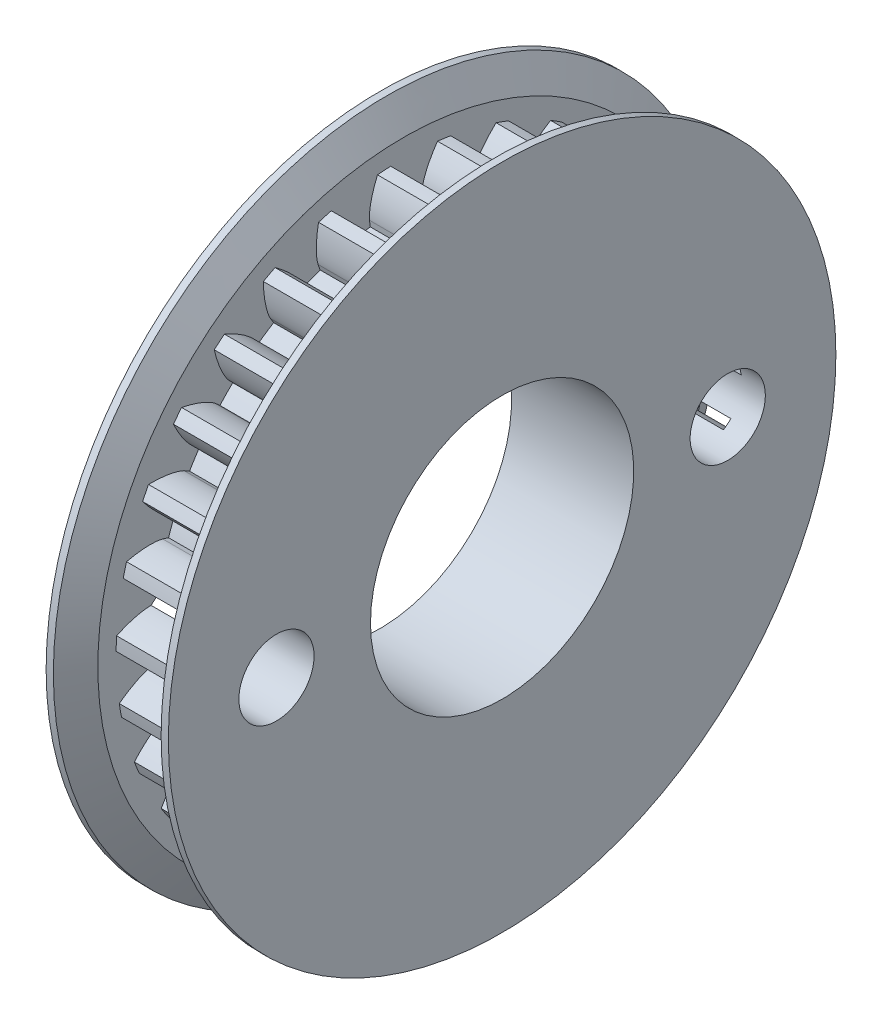
from build123d import *

# Parameters (mm, degrees)
SKETCH1_R                 = 15.278874537
BOSS_EXTRUDE1_DEPTH       = 4
CUT_EXTRUDE1_DEPTH        = 22.974713064
CIRPATTERN6_COUNT         = 30
CIRPATTERN6_COPY_1_DEPTH  = 22.974713064
CIRPATTERN6_COPY_2_DEPTH  = 22.974713064
CIRPATTERN6_COPY_3_DEPTH  = 22.974713064
CIRPATTERN6_COPY_4_DEPTH  = 22.974713064
CIRPATTERN6_COPY_5_DEPTH  = 22.974713064
CIRPATTERN6_COPY_6_DEPTH  = 22.974713064
CIRPATTERN6_COPY_7_DEPTH  = 22.974713064
CIRPATTERN6_COPY_8_DEPTH  = 22.974713064
CIRPATTERN6_COPY_9_DEPTH  = 22.974713064
CIRPATTERN6_COPY_10_DEPTH = 22.974713064
CIRPATTERN6_COPY_11_DEPTH = 22.974713064
CIRPATTERN6_COPY_12_DEPTH = 22.974713064
CIRPATTERN6_COPY_13_DEPTH = 22.974713064
CIRPATTERN6_COPY_14_DEPTH = 22.974713064
CIRPATTERN6_COPY_15_DEPTH = 22.974713064
CIRPATTERN6_COPY_16_DEPTH = 22.974713064
CIRPATTERN6_COPY_17_DEPTH = 22.974713064
CIRPATTERN6_COPY_18_DEPTH = 22.974713064
CIRPATTERN6_COPY_19_DEPTH = 22.974713064
CIRPATTERN6_COPY_20_DEPTH = 22.974713064
CIRPATTERN6_COPY_21_DEPTH = 22.974713064
CIRPATTERN6_COPY_22_DEPTH = 22.974713064
CIRPATTERN6_COPY_23_DEPTH = 22.974713064
CIRPATTERN6_COPY_24_DEPTH = 22.974713064
CIRPATTERN6_COPY_25_DEPTH = 22.974713064
CIRPATTERN6_COPY_26_DEPTH = 22.974713064
CIRPATTERN6_COPY_27_DEPTH = 22.974713064
CIRPATTERN6_COPY_28_DEPTH = 22.974713064
CIRPATTERN6_COPY_29_DEPTH = 22.974713064
SKETCH6_R                 = 7
CUT_EXTRUDE2_DEPTH        = 26.931455592
CUT_EXTRUDE3_DEPTH        = 26.646693531
CUT_EXTRUDE3_DEPTH_BACK   = 26.646693531
SKETCH7_R                 = 2


with BuildPart() as part:
    # Sketch1 → Boss-Extrude1 (new body)
    with BuildSketch(Plane.YZ):
        Circle(SKETCH1_R)
    extrude(amount=BOSS_EXTRUDE1_DEPTH)

    # Sketch3 → Cut-Extrude1 (cut, through all)
    with BuildSketch(Plane.YZ.offset(4)):
        with BuildLine():
            Line((13.450664749, -0.504036274), (14.313898451, -0.536384199))
            Line((14.313898451, -0.536384199), (15.268158348, -0.572143146))
            ThreePointArc((15.268158348, -0.572143146), (15.276195255, -0.286121747), (15.278874537, 0))
            ThreePointArc((15.278874537, 0), (15.275140151, 0.337787637), (15.263938818, 0.675410153))
            add(Edge.make_bspline(
                [(13.460105303, 0), (13.470056402, 0.000210583), (13.49794505, 0.001452893), (13.55055342, 0.006373717), (13.636042534, 0.018043706), (13.744308514, 0.038242293), (13.8832192, 0.070428659), (14.045297726, 0.116107191), (14.221468807, 0.174364449), (14.410716831, 0.246340875), (14.597138914, 0.32567041), (14.78066653, 0.411715422), (14.961146978, 0.503609331), (15.104113083, 0.582178756), (15.201386343, 0.638320962), (15.254446962, 0.66975989), (15.263938818, 0.675410153)],
                knots=[0, 0, 0, 0, 0, 0.005376748, 0.015083688, 0.02853182, 0.046610139, 0.064854849, 0.092110525, 0.119476175, 0.146842495, 0.174208853, 0.201574955, 0.228941013, 0.256307345, 0.262278114, 0.262278114, 0.262278114, 0.262278114, 0.262278114], degree=4))
            Line((13.460105303, 0), (13.130282805, 0))
            ThreePointArc((13.130282805, 0), (13.127980297, -0.245885876), (13.12107358, -0.491685516))
            Line((13.12107358, -0.491685516), (13.450664749, -0.504036274))
        make_face()
    cut_extrude1 = extrude(amount=-CUT_EXTRUDE1_DEPTH, mode=Mode.SUBTRACT)

    # Mirror1: Cut-Extrude1 across plane
    add(cut_extrude1.mirror(Plane(origin=(0, 0, 0), x_dir=(1, 0, 0), z_dir=(0, 0.037446681316417124, 0.999298627067198))), mode=Mode.SUBTRACT)

    # CirPattern6: Cut-Extrude1 ×30 about axis
    cirpattern6_axis = Axis((4, 0, 0), (-1, 0, 0))
    for i in range(1, CIRPATTERN6_COUNT):
        add(cut_extrude1.rotate(cirpattern6_axis, i * 360 / CIRPATTERN6_COUNT), mode=Mode.SUBTRACT)

    # CirPattern6 copy 1 sketch → CirPattern6 copy 1 (cut, through all)
    with BuildSketch(Plane(origin=(4, 0, 0), x_dir=(0, 0.9598440936427466, -0.2805339835013476), z_dir=(1, 0, 0))):
        with BuildLine():
            Line((13.450664749, 0.504036274), (14.313898451, 0.536384199))
            Line((14.313898451, 0.536384199), (15.268158348, 0.572143146))
            ThreePointArc((15.268158348, 0.572143146), (15.276195255, 0.286121747), (15.278874537, 0))
            ThreePointArc((15.278874537, 0), (15.275140151, -0.337787637), (15.263938818, -0.675410153))
            add(Edge.make_bspline(
                [(13.460105303, 0), (13.470056402, -0.000210583), (13.49794505, -0.001452893), (13.55055342, -0.006373717), (13.636042534, -0.018043706), (13.744308514, -0.038242293), (13.8832192, -0.070428659), (14.045297726, -0.116107191), (14.221468807, -0.174364449), (14.410716831, -0.246340875), (14.597138914, -0.32567041), (14.78066653, -0.411715422), (14.961146978, -0.503609331), (15.104113083, -0.582178756), (15.201386343, -0.638320962), (15.254446962, -0.66975989), (15.263938818, -0.675410153)],
                knots=[0, 0, 0, 0, 0, 0.005376748, 0.015083688, 0.02853182, 0.046610139, 0.064854849, 0.092110525, 0.119476175, 0.146842495, 0.174208853, 0.201574955, 0.228941013, 0.256307345, 0.262278114, 0.262278114, 0.262278114, 0.262278114, 0.262278114], degree=4))
            Line((13.460105303, 0), (13.130282805, 0))
            ThreePointArc((13.130282805, 0), (13.127980297, 0.245885876), (13.12107358, 0.491685516))
            Line((13.12107358, 0.491685516), (13.450664749, 0.504036274))
        make_face()
    extrude(amount=-CIRPATTERN6_COPY_1_DEPTH, mode=Mode.SUBTRACT)

    # CirPattern6 copy 2 sketch → CirPattern6 copy 2 (cut, through all)
    with BuildSketch(Plane(origin=(4, 0, 0), x_dir=(0, 0.8805429024335603, -0.47396645131684334), z_dir=(1, 0, 0))):
        with BuildLine():
            Line((13.450664749, 0.504036274), (14.313898451, 0.536384199))
            Line((14.313898451, 0.536384199), (15.268158348, 0.572143146))
            ThreePointArc((15.268158348, 0.572143146), (15.276195255, 0.286121747), (15.278874537, 0))
            ThreePointArc((15.278874537, 0), (15.275140151, -0.337787637), (15.263938818, -0.675410153))
            add(Edge.make_bspline(
                [(13.460105303, 0), (13.470056402, -0.000210583), (13.49794505, -0.001452893), (13.55055342, -0.006373717), (13.636042534, -0.018043706), (13.744308514, -0.038242293), (13.8832192, -0.070428659), (14.045297726, -0.116107191), (14.221468807, -0.174364449), (14.410716831, -0.246340875), (14.597138914, -0.32567041), (14.78066653, -0.411715422), (14.961146978, -0.503609331), (15.104113083, -0.582178756), (15.201386343, -0.638320962), (15.254446962, -0.66975989), (15.263938818, -0.675410153)],
                knots=[0, 0, 0, 0, 0, 0.005376748, 0.015083688, 0.02853182, 0.046610139, 0.064854849, 0.092110525, 0.119476175, 0.146842495, 0.174208853, 0.201574955, 0.228941013, 0.256307345, 0.262278114, 0.262278114, 0.262278114, 0.262278114, 0.262278114], degree=4))
            Line((13.460105303, 0), (13.130282805, 0))
            ThreePointArc((13.130282805, 0), (13.127980297, 0.245885876), (13.12107358, 0.491685516))
            Line((13.12107358, 0.491685516), (13.450664749, 0.504036274))
        make_face()
    extrude(amount=-CIRPATTERN6_COPY_2_DEPTH, mode=Mode.SUBTRACT)

    # CirPattern6 copy 3 sketch → CirPattern6 copy 3 (cut, through all)
    with BuildSketch(Plane(origin=(4, 0, 0), x_dir=(0, 0.7627577610743903, -0.6466843108664252), z_dir=(1, 0, 0))):
        with BuildLine():
            Line((13.450664749, 0.504036274), (14.313898451, 0.536384199))
            Line((14.313898451, 0.536384199), (15.268158348, 0.572143146))
            ThreePointArc((15.268158348, 0.572143146), (15.276195255, 0.286121747), (15.278874537, 0))
            ThreePointArc((15.278874537, 0), (15.275140151, -0.337787637), (15.263938818, -0.675410153))
            add(Edge.make_bspline(
                [(13.460105303, 0), (13.470056402, -0.000210583), (13.49794505, -0.001452893), (13.55055342, -0.006373717), (13.636042534, -0.018043706), (13.744308514, -0.038242293), (13.8832192, -0.070428659), (14.045297726, -0.116107191), (14.221468807, -0.174364449), (14.410716831, -0.246340875), (14.597138914, -0.32567041), (14.78066653, -0.411715422), (14.961146978, -0.503609331), (15.104113083, -0.582178756), (15.201386343, -0.638320962), (15.254446962, -0.66975989), (15.263938818, -0.675410153)],
                knots=[0, 0, 0, 0, 0, 0.005376748, 0.015083688, 0.02853182, 0.046610139, 0.064854849, 0.092110525, 0.119476175, 0.146842495, 0.174208853, 0.201574955, 0.228941013, 0.256307345, 0.262278114, 0.262278114, 0.262278114, 0.262278114, 0.262278114], degree=4))
            Line((13.460105303, 0), (13.130282805, 0))
            ThreePointArc((13.130282805, 0), (13.127980297, 0.245885876), (13.12107358, 0.491685516))
            Line((13.12107358, 0.491685516), (13.450664749, 0.504036274))
        make_face()
    extrude(amount=-CIRPATTERN6_COPY_3_DEPTH, mode=Mode.SUBTRACT)

    # CirPattern6 copy 4 sketch → CirPattern6 copy 4 (cut, through all)
    with BuildSketch(Plane(origin=(4, 0, 0), x_dir=(0, 0.6116364454384483, -0.7911389628955334), z_dir=(1, 0, 0))):
        with BuildLine():
            Line((13.450664749, 0.504036274), (14.313898451, 0.536384199))
            Line((14.313898451, 0.536384199), (15.268158348, 0.572143146))
            ThreePointArc((15.268158348, 0.572143146), (15.276195255, 0.286121747), (15.278874537, 0))
            ThreePointArc((15.278874537, 0), (15.275140151, -0.337787637), (15.263938818, -0.675410153))
            add(Edge.make_bspline(
                [(13.460105303, 0), (13.470056402, -0.000210583), (13.49794505, -0.001452893), (13.55055342, -0.006373717), (13.636042534, -0.018043706), (13.744308514, -0.038242293), (13.8832192, -0.070428659), (14.045297726, -0.116107191), (14.221468807, -0.174364449), (14.410716831, -0.246340875), (14.597138914, -0.32567041), (14.78066653, -0.411715422), (14.961146978, -0.503609331), (15.104113083, -0.582178756), (15.201386343, -0.638320962), (15.254446962, -0.66975989), (15.263938818, -0.675410153)],
                knots=[0, 0, 0, 0, 0, 0.005376748, 0.015083688, 0.02853182, 0.046610139, 0.064854849, 0.092110525, 0.119476175, 0.146842495, 0.174208853, 0.201574955, 0.228941013, 0.256307345, 0.262278114, 0.262278114, 0.262278114, 0.262278114, 0.262278114], degree=4))
            Line((13.460105303, 0), (13.130282805, 0))
            ThreePointArc((13.130282805, 0), (13.127980297, 0.245885876), (13.12107358, 0.491685516))
            Line((13.12107358, 0.491685516), (13.450664749, 0.504036274))
        make_face()
    extrude(amount=-CIRPATTERN6_COPY_4_DEPTH, mode=Mode.SUBTRACT)

    # CirPattern6 copy 5 sketch → CirPattern6 copy 5 (cut, through all)
    with BuildSketch(Plane(origin=(4, 0, 0), x_dir=(0, 0.4337836821795526, -0.9010170459401691), z_dir=(1, 0, 0))):
        with BuildLine():
            Line((13.450664749, 0.504036274), (14.313898451, 0.536384199))
            Line((14.313898451, 0.536384199), (15.268158348, 0.572143146))
            ThreePointArc((15.268158348, 0.572143146), (15.276195255, 0.286121747), (15.278874537, 0))
            ThreePointArc((15.278874537, 0), (15.275140151, -0.337787637), (15.263938818, -0.675410153))
            add(Edge.make_bspline(
                [(13.460105303, 0), (13.470056402, -0.000210583), (13.49794505, -0.001452893), (13.55055342, -0.006373717), (13.636042534, -0.018043706), (13.744308514, -0.038242293), (13.8832192, -0.070428659), (14.045297726, -0.116107191), (14.221468807, -0.174364449), (14.410716831, -0.246340875), (14.597138914, -0.32567041), (14.78066653, -0.411715422), (14.961146978, -0.503609331), (15.104113083, -0.582178756), (15.201386343, -0.638320962), (15.254446962, -0.66975989), (15.263938818, -0.675410153)],
                knots=[0, 0, 0, 0, 0, 0.005376748, 0.015083688, 0.02853182, 0.046610139, 0.064854849, 0.092110525, 0.119476175, 0.146842495, 0.174208853, 0.201574955, 0.228941013, 0.256307345, 0.262278114, 0.262278114, 0.262278114, 0.262278114, 0.262278114], degree=4))
            Line((13.460105303, 0), (13.130282805, 0))
            ThreePointArc((13.130282805, 0), (13.127980297, 0.245885876), (13.12107358, 0.491685516))
            Line((13.12107358, 0.491685516), (13.450664749, 0.504036274))
        make_face()
    extrude(amount=-CIRPATTERN6_COPY_5_DEPTH, mode=Mode.SUBTRACT)

    # CirPattern6 copy 6 sketch → CirPattern6 copy 6 (cut, through all)
    with BuildSketch(Plane(origin=(4, 0, 0), x_dir=(0, 0.23697249048436164, -0.9715163605177419), z_dir=(1, 0, 0))):
        with BuildLine():
            Line((13.450664749, 0.504036274), (14.313898451, 0.536384199))
            Line((14.313898451, 0.536384199), (15.268158348, 0.572143146))
            ThreePointArc((15.268158348, 0.572143146), (15.276195255, 0.286121747), (15.278874537, 0))
            ThreePointArc((15.278874537, 0), (15.275140151, -0.337787637), (15.263938818, -0.675410153))
            add(Edge.make_bspline(
                [(13.460105303, 0), (13.470056402, -0.000210583), (13.49794505, -0.001452893), (13.55055342, -0.006373717), (13.636042534, -0.018043706), (13.744308514, -0.038242293), (13.8832192, -0.070428659), (14.045297726, -0.116107191), (14.221468807, -0.174364449), (14.410716831, -0.246340875), (14.597138914, -0.32567041), (14.78066653, -0.411715422), (14.961146978, -0.503609331), (15.104113083, -0.582178756), (15.201386343, -0.638320962), (15.254446962, -0.66975989), (15.263938818, -0.675410153)],
                knots=[0, 0, 0, 0, 0, 0.005376748, 0.015083688, 0.02853182, 0.046610139, 0.064854849, 0.092110525, 0.119476175, 0.146842495, 0.174208853, 0.201574955, 0.228941013, 0.256307345, 0.262278114, 0.262278114, 0.262278114, 0.262278114, 0.262278114], degree=4))
            Line((13.460105303, 0), (13.130282805, 0))
            ThreePointArc((13.130282805, 0), (13.127980297, 0.245885876), (13.12107358, 0.491685516))
            Line((13.12107358, 0.491685516), (13.450664749, 0.504036274))
        make_face()
    extrude(amount=-CIRPATTERN6_COPY_6_DEPTH, mode=Mode.SUBTRACT)

    # CirPattern6 copy 7 sketch → CirPattern6 copy 7 (cut, through all)
    with BuildSketch(Plane(origin=(4, 0, 0), x_dir=(0, 0.02980446383483333, -0.9995557482879672), z_dir=(1, 0, 0))):
        with BuildLine():
            Line((13.450664749, 0.504036274), (14.313898451, 0.536384199))
            Line((14.313898451, 0.536384199), (15.268158348, 0.572143146))
            ThreePointArc((15.268158348, 0.572143146), (15.276195255, 0.286121747), (15.278874537, 0))
            ThreePointArc((15.278874537, 0), (15.275140151, -0.337787637), (15.263938818, -0.675410153))
            add(Edge.make_bspline(
                [(13.460105303, 0), (13.470056402, -0.000210583), (13.49794505, -0.001452893), (13.55055342, -0.006373717), (13.636042534, -0.018043706), (13.744308514, -0.038242293), (13.8832192, -0.070428659), (14.045297726, -0.116107191), (14.221468807, -0.174364449), (14.410716831, -0.246340875), (14.597138914, -0.32567041), (14.78066653, -0.411715422), (14.961146978, -0.503609331), (15.104113083, -0.582178756), (15.201386343, -0.638320962), (15.254446962, -0.66975989), (15.263938818, -0.675410153)],
                knots=[0, 0, 0, 0, 0, 0.005376748, 0.015083688, 0.02853182, 0.046610139, 0.064854849, 0.092110525, 0.119476175, 0.146842495, 0.174208853, 0.201574955, 0.228941013, 0.256307345, 0.262278114, 0.262278114, 0.262278114, 0.262278114, 0.262278114], degree=4))
            Line((13.460105303, 0), (13.130282805, 0))
            ThreePointArc((13.130282805, 0), (13.127980297, 0.245885876), (13.12107358, 0.491685516))
            Line((13.12107358, 0.491685516), (13.450664749, 0.504036274))
        make_face()
    extrude(amount=-CIRPATTERN6_COPY_7_DEPTH, mode=Mode.SUBTRACT)

    # CirPattern6 copy 8 sketch → CirPattern6 copy 8 (cut, through all)
    with BuildSketch(Plane(origin=(4, 0, 0), x_dir=(0, -0.17866616090196227, -0.9839097534573759), z_dir=(1, 0, 0))):
        with BuildLine():
            Line((13.450664749, 0.504036274), (14.313898451, 0.536384199))
            Line((14.313898451, 0.536384199), (15.268158348, 0.572143146))
            ThreePointArc((15.268158348, 0.572143146), (15.276195255, 0.286121747), (15.278874537, 0))
            ThreePointArc((15.278874537, 0), (15.275140151, -0.337787637), (15.263938818, -0.675410153))
            add(Edge.make_bspline(
                [(13.460105303, 0), (13.470056402, -0.000210583), (13.49794505, -0.001452893), (13.55055342, -0.006373717), (13.636042534, -0.018043706), (13.744308514, -0.038242293), (13.8832192, -0.070428659), (14.045297726, -0.116107191), (14.221468807, -0.174364449), (14.410716831, -0.246340875), (14.597138914, -0.32567041), (14.78066653, -0.411715422), (14.961146978, -0.503609331), (15.104113083, -0.582178756), (15.201386343, -0.638320962), (15.254446962, -0.66975989), (15.263938818, -0.675410153)],
                knots=[0, 0, 0, 0, 0, 0.005376748, 0.015083688, 0.02853182, 0.046610139, 0.064854849, 0.092110525, 0.119476175, 0.146842495, 0.174208853, 0.201574955, 0.228941013, 0.256307345, 0.262278114, 0.262278114, 0.262278114, 0.262278114, 0.262278114], degree=4))
            Line((13.460105303, 0), (13.130282805, 0))
            ThreePointArc((13.130282805, 0), (13.127980297, 0.245885876), (13.12107358, 0.491685516))
            Line((13.12107358, 0.491685516), (13.450664749, 0.504036274))
        make_face()
    extrude(amount=-CIRPATTERN6_COPY_8_DEPTH, mode=Mode.SUBTRACT)

    # CirPattern6 copy 9 sketch → CirPattern6 copy 9 (cut, through all)
    with BuildSketch(Plane(origin=(4, 0, 0), x_dir=(0, -0.37932821707198205, -0.9252621810778777), z_dir=(1, 0, 0))):
        with BuildLine():
            Line((13.450664749, 0.504036274), (14.313898451, 0.536384199))
            Line((14.313898451, 0.536384199), (15.268158348, 0.572143146))
            ThreePointArc((15.268158348, 0.572143146), (15.276195255, 0.286121747), (15.278874537, 0))
            ThreePointArc((15.278874537, 0), (15.275140151, -0.337787637), (15.263938818, -0.675410153))
            add(Edge.make_bspline(
                [(13.460105303, 0), (13.470056402, -0.000210583), (13.49794505, -0.001452893), (13.55055342, -0.006373717), (13.636042534, -0.018043706), (13.744308514, -0.038242293), (13.8832192, -0.070428659), (14.045297726, -0.116107191), (14.221468807, -0.174364449), (14.410716831, -0.246340875), (14.597138914, -0.32567041), (14.78066653, -0.411715422), (14.961146978, -0.503609331), (15.104113083, -0.582178756), (15.201386343, -0.638320962), (15.254446962, -0.66975989), (15.263938818, -0.675410153)],
                knots=[0, 0, 0, 0, 0, 0.005376748, 0.015083688, 0.02853182, 0.046610139, 0.064854849, 0.092110525, 0.119476175, 0.146842495, 0.174208853, 0.201574955, 0.228941013, 0.256307345, 0.262278114, 0.262278114, 0.262278114, 0.262278114, 0.262278114], degree=4))
            Line((13.460105303, 0), (13.130282805, 0))
            ThreePointArc((13.130282805, 0), (13.127980297, 0.245885876), (13.12107358, 0.491685516))
            Line((13.12107358, 0.491685516), (13.450664749, 0.504036274))
        make_face()
    extrude(amount=-CIRPATTERN6_COPY_9_DEPTH, mode=Mode.SUBTRACT)

    # CirPattern6 copy 10 sketch → CirPattern6 copy 10 (cut, through all)
    with BuildSketch(Plane(origin=(4, 0, 0), x_dir=(0, -0.5634118099372207, -0.8261762114847322), z_dir=(1, 0, 0))):
        with BuildLine():
            Line((13.450664749, 0.504036274), (14.313898451, 0.536384199))
            Line((14.313898451, 0.536384199), (15.268158348, 0.572143146))
            ThreePointArc((15.268158348, 0.572143146), (15.276195255, 0.286121747), (15.278874537, 0))
            ThreePointArc((15.278874537, 0), (15.275140151, -0.337787637), (15.263938818, -0.675410153))
            add(Edge.make_bspline(
                [(13.460105303, 0), (13.470056402, -0.000210583), (13.49794505, -0.001452893), (13.55055342, -0.006373717), (13.636042534, -0.018043706), (13.744308514, -0.038242293), (13.8832192, -0.070428659), (14.045297726, -0.116107191), (14.221468807, -0.174364449), (14.410716831, -0.246340875), (14.597138914, -0.32567041), (14.78066653, -0.411715422), (14.961146978, -0.503609331), (15.104113083, -0.582178756), (15.201386343, -0.638320962), (15.254446962, -0.66975989), (15.263938818, -0.675410153)],
                knots=[0, 0, 0, 0, 0, 0.005376748, 0.015083688, 0.02853182, 0.046610139, 0.064854849, 0.092110525, 0.119476175, 0.146842495, 0.174208853, 0.201574955, 0.228941013, 0.256307345, 0.262278114, 0.262278114, 0.262278114, 0.262278114, 0.262278114], degree=4))
            Line((13.460105303, 0), (13.130282805, 0))
            ThreePointArc((13.130282805, 0), (13.127980297, 0.245885876), (13.12107358, 0.491685516))
            Line((13.12107358, 0.491685516), (13.450664749, 0.504036274))
        make_face()
    extrude(amount=-CIRPATTERN6_COPY_10_DEPTH, mode=Mode.SUBTRACT)

    # CirPattern6 copy 11 sketch → CirPattern6 copy 11 (cut, through all)
    with BuildSketch(Plane(origin=(4, 0, 0), x_dir=(0, -0.722871603158385, -0.6909823770163943), z_dir=(1, 0, 0))):
        with BuildLine():
            Line((13.450664749, 0.504036274), (14.313898451, 0.536384199))
            Line((14.313898451, 0.536384199), (15.268158348, 0.572143146))
            ThreePointArc((15.268158348, 0.572143146), (15.276195255, 0.286121747), (15.278874537, 0))
            ThreePointArc((15.278874537, 0), (15.275140151, -0.337787637), (15.263938818, -0.675410153))
            add(Edge.make_bspline(
                [(13.460105303, 0), (13.470056402, -0.000210583), (13.49794505, -0.001452893), (13.55055342, -0.006373717), (13.636042534, -0.018043706), (13.744308514, -0.038242293), (13.8832192, -0.070428659), (14.045297726, -0.116107191), (14.221468807, -0.174364449), (14.410716831, -0.246340875), (14.597138914, -0.32567041), (14.78066653, -0.411715422), (14.961146978, -0.503609331), (15.104113083, -0.582178756), (15.201386343, -0.638320962), (15.254446962, -0.66975989), (15.263938818, -0.675410153)],
                knots=[0, 0, 0, 0, 0, 0.005376748, 0.015083688, 0.02853182, 0.046610139, 0.064854849, 0.092110525, 0.119476175, 0.146842495, 0.174208853, 0.201574955, 0.228941013, 0.256307345, 0.262278114, 0.262278114, 0.262278114, 0.262278114, 0.262278114], degree=4))
            Line((13.460105303, 0), (13.130282805, 0))
            ThreePointArc((13.130282805, 0), (13.127980297, 0.245885876), (13.12107358, 0.491685516))
            Line((13.12107358, 0.491685516), (13.450664749, 0.504036274))
        make_face()
    extrude(amount=-CIRPATTERN6_COPY_11_DEPTH, mode=Mode.SUBTRACT)

    # CirPattern6 copy 12 sketch → CirPattern6 copy 12 (cut, through all)
    with BuildSketch(Plane(origin=(4, 0, 0), x_dir=(0, -0.8507384385987268, -0.525589296971124), z_dir=(1, 0, 0))):
        with BuildLine():
            Line((13.450664749, 0.504036274), (14.313898451, 0.536384199))
            Line((14.313898451, 0.536384199), (15.268158348, 0.572143146))
            ThreePointArc((15.268158348, 0.572143146), (15.276195255, 0.286121747), (15.278874537, 0))
            ThreePointArc((15.278874537, 0), (15.275140151, -0.337787637), (15.263938818, -0.675410153))
            add(Edge.make_bspline(
                [(13.460105303, 0), (13.470056402, -0.000210583), (13.49794505, -0.001452893), (13.55055342, -0.006373717), (13.636042534, -0.018043706), (13.744308514, -0.038242293), (13.8832192, -0.070428659), (14.045297726, -0.116107191), (14.221468807, -0.174364449), (14.410716831, -0.246340875), (14.597138914, -0.32567041), (14.78066653, -0.411715422), (14.961146978, -0.503609331), (15.104113083, -0.582178756), (15.201386343, -0.638320962), (15.254446962, -0.66975989), (15.263938818, -0.675410153)],
                knots=[0, 0, 0, 0, 0, 0.005376748, 0.015083688, 0.02853182, 0.046610139, 0.064854849, 0.092110525, 0.119476175, 0.146842495, 0.174208853, 0.201574955, 0.228941013, 0.256307345, 0.262278114, 0.262278114, 0.262278114, 0.262278114, 0.262278114], degree=4))
            Line((13.460105303, 0), (13.130282805, 0))
            ThreePointArc((13.130282805, 0), (13.127980297, 0.245885876), (13.12107358, 0.491685516))
            Line((13.12107358, 0.491685516), (13.450664749, 0.504036274))
        make_face()
    extrude(amount=-CIRPATTERN6_COPY_12_DEPTH, mode=Mode.SUBTRACT)

    # CirPattern6 copy 13 sketch → CirPattern6 copy 13 (cut, through all)
    with BuildSketch(Plane(origin=(4, 0, 0), x_dir=(0, -0.9414239219763524, -0.3372254425909509), z_dir=(1, 0, 0))):
        with BuildLine():
            Line((13.450664749, 0.504036274), (14.313898451, 0.536384199))
            Line((14.313898451, 0.536384199), (15.268158348, 0.572143146))
            ThreePointArc((15.268158348, 0.572143146), (15.276195255, 0.286121747), (15.278874537, 0))
            ThreePointArc((15.278874537, 0), (15.275140151, -0.337787637), (15.263938818, -0.675410153))
            add(Edge.make_bspline(
                [(13.460105303, 0), (13.470056402, -0.000210583), (13.49794505, -0.001452893), (13.55055342, -0.006373717), (13.636042534, -0.018043706), (13.744308514, -0.038242293), (13.8832192, -0.070428659), (14.045297726, -0.116107191), (14.221468807, -0.174364449), (14.410716831, -0.246340875), (14.597138914, -0.32567041), (14.78066653, -0.411715422), (14.961146978, -0.503609331), (15.104113083, -0.582178756), (15.201386343, -0.638320962), (15.254446962, -0.66975989), (15.263938818, -0.675410153)],
                knots=[0, 0, 0, 0, 0, 0.005376748, 0.015083688, 0.02853182, 0.046610139, 0.064854849, 0.092110525, 0.119476175, 0.146842495, 0.174208853, 0.201574955, 0.228941013, 0.256307345, 0.262278114, 0.262278114, 0.262278114, 0.262278114, 0.262278114], degree=4))
            Line((13.460105303, 0), (13.130282805, 0))
            ThreePointArc((13.130282805, 0), (13.127980297, 0.245885876), (13.12107358, 0.491685516))
            Line((13.12107358, 0.491685516), (13.450664749, 0.504036274))
        make_face()
    extrude(amount=-CIRPATTERN6_COPY_13_DEPTH, mode=Mode.SUBTRACT)

    # CirPattern6 copy 14 sketch → CirPattern6 copy 14 (cut, through all)
    with BuildSketch(Plane(origin=(4, 0, 0), x_dir=(0, -0.9909646625104305, -0.13412321818234424), z_dir=(1, 0, 0))):
        with BuildLine():
            Line((13.450664749, 0.504036274), (14.313898451, 0.536384199))
            Line((14.313898451, 0.536384199), (15.268158348, 0.572143146))
            ThreePointArc((15.268158348, 0.572143146), (15.276195255, 0.286121747), (15.278874537, 0))
            ThreePointArc((15.278874537, 0), (15.275140151, -0.337787637), (15.263938818, -0.675410153))
            add(Edge.make_bspline(
                [(13.460105303, 0), (13.470056402, -0.000210583), (13.49794505, -0.001452893), (13.55055342, -0.006373717), (13.636042534, -0.018043706), (13.744308514, -0.038242293), (13.8832192, -0.070428659), (14.045297726, -0.116107191), (14.221468807, -0.174364449), (14.410716831, -0.246340875), (14.597138914, -0.32567041), (14.78066653, -0.411715422), (14.961146978, -0.503609331), (15.104113083, -0.582178756), (15.201386343, -0.638320962), (15.254446962, -0.66975989), (15.263938818, -0.675410153)],
                knots=[0, 0, 0, 0, 0, 0.005376748, 0.015083688, 0.02853182, 0.046610139, 0.064854849, 0.092110525, 0.119476175, 0.146842495, 0.174208853, 0.201574955, 0.228941013, 0.256307345, 0.262278114, 0.262278114, 0.262278114, 0.262278114, 0.262278114], degree=4))
            Line((13.460105303, 0), (13.130282805, 0))
            ThreePointArc((13.130282805, 0), (13.127980297, 0.245885876), (13.12107358, 0.491685516))
            Line((13.12107358, 0.491685516), (13.450664749, 0.504036274))
        make_face()
    extrude(amount=-CIRPATTERN6_COPY_14_DEPTH, mode=Mode.SUBTRACT)

    # CirPattern6 copy 15 sketch → CirPattern6 copy 15 (cut, through all)
    with BuildSketch(Plane(origin=(4, 0, 0), x_dir=(0, -0.9971954921167734, 0.07484083445543692), z_dir=(1, 0, 0))):
        with BuildLine():
            Line((13.450664749, 0.504036274), (14.313898451, 0.536384199))
            Line((14.313898451, 0.536384199), (15.268158348, 0.572143146))
            ThreePointArc((15.268158348, 0.572143146), (15.276195255, 0.286121747), (15.278874537, 0))
            ThreePointArc((15.278874537, 0), (15.275140151, -0.337787637), (15.263938818, -0.675410153))
            add(Edge.make_bspline(
                [(13.460105303, 0), (13.470056402, -0.000210583), (13.49794505, -0.001452893), (13.55055342, -0.006373717), (13.636042534, -0.018043706), (13.744308514, -0.038242293), (13.8832192, -0.070428659), (14.045297726, -0.116107191), (14.221468807, -0.174364449), (14.410716831, -0.246340875), (14.597138914, -0.32567041), (14.78066653, -0.411715422), (14.961146978, -0.503609331), (15.104113083, -0.582178756), (15.201386343, -0.638320962), (15.254446962, -0.66975989), (15.263938818, -0.675410153)],
                knots=[0, 0, 0, 0, 0, 0.005376748, 0.015083688, 0.02853182, 0.046610139, 0.064854849, 0.092110525, 0.119476175, 0.146842495, 0.174208853, 0.201574955, 0.228941013, 0.256307345, 0.262278114, 0.262278114, 0.262278114, 0.262278114, 0.262278114], degree=4))
            Line((13.460105303, 0), (13.130282805, 0))
            ThreePointArc((13.130282805, 0), (13.127980297, 0.245885876), (13.12107358, 0.491685516))
            Line((13.12107358, 0.491685516), (13.450664749, 0.504036274))
        make_face()
    extrude(amount=-CIRPATTERN6_COPY_15_DEPTH, mode=Mode.SUBTRACT)

    # CirPattern6 copy 16 sketch → CirPattern6 copy 16 (cut, through all)
    with BuildSketch(Plane(origin=(4, 0, 0), x_dir=(0, -0.9598440936427465, 0.2805339835013478), z_dir=(1, 0, 0))):
        with BuildLine():
            Line((13.450664749, 0.504036274), (14.313898451, 0.536384199))
            Line((14.313898451, 0.536384199), (15.268158348, 0.572143146))
            ThreePointArc((15.268158348, 0.572143146), (15.276195255, 0.286121747), (15.278874537, 0))
            ThreePointArc((15.278874537, 0), (15.275140151, -0.337787637), (15.263938818, -0.675410153))
            add(Edge.make_bspline(
                [(13.460105303, 0), (13.470056402, -0.000210583), (13.49794505, -0.001452893), (13.55055342, -0.006373717), (13.636042534, -0.018043706), (13.744308514, -0.038242293), (13.8832192, -0.070428659), (14.045297726, -0.116107191), (14.221468807, -0.174364449), (14.410716831, -0.246340875), (14.597138914, -0.32567041), (14.78066653, -0.411715422), (14.961146978, -0.503609331), (15.104113083, -0.582178756), (15.201386343, -0.638320962), (15.254446962, -0.66975989), (15.263938818, -0.675410153)],
                knots=[0, 0, 0, 0, 0, 0.005376748, 0.015083688, 0.02853182, 0.046610139, 0.064854849, 0.092110525, 0.119476175, 0.146842495, 0.174208853, 0.201574955, 0.228941013, 0.256307345, 0.262278114, 0.262278114, 0.262278114, 0.262278114, 0.262278114], degree=4))
            Line((13.460105303, 0), (13.130282805, 0))
            ThreePointArc((13.130282805, 0), (13.127980297, 0.245885876), (13.12107358, 0.491685516))
            Line((13.12107358, 0.491685516), (13.450664749, 0.504036274))
        make_face()
    extrude(amount=-CIRPATTERN6_COPY_16_DEPTH, mode=Mode.SUBTRACT)

    # CirPattern6 copy 17 sketch → CirPattern6 copy 17 (cut, through all)
    with BuildSketch(Plane(origin=(4, 0, 0), x_dir=(0, -0.8805429024335603, 0.47396645131684334), z_dir=(1, 0, 0))):
        with BuildLine():
            Line((13.450664749, 0.504036274), (14.313898451, 0.536384199))
            Line((14.313898451, 0.536384199), (15.268158348, 0.572143146))
            ThreePointArc((15.268158348, 0.572143146), (15.276195255, 0.286121747), (15.278874537, 0))
            ThreePointArc((15.278874537, 0), (15.275140151, -0.337787637), (15.263938818, -0.675410153))
            add(Edge.make_bspline(
                [(13.460105303, 0), (13.470056402, -0.000210583), (13.49794505, -0.001452893), (13.55055342, -0.006373717), (13.636042534, -0.018043706), (13.744308514, -0.038242293), (13.8832192, -0.070428659), (14.045297726, -0.116107191), (14.221468807, -0.174364449), (14.410716831, -0.246340875), (14.597138914, -0.32567041), (14.78066653, -0.411715422), (14.961146978, -0.503609331), (15.104113083, -0.582178756), (15.201386343, -0.638320962), (15.254446962, -0.66975989), (15.263938818, -0.675410153)],
                knots=[0, 0, 0, 0, 0, 0.005376748, 0.015083688, 0.02853182, 0.046610139, 0.064854849, 0.092110525, 0.119476175, 0.146842495, 0.174208853, 0.201574955, 0.228941013, 0.256307345, 0.262278114, 0.262278114, 0.262278114, 0.262278114, 0.262278114], degree=4))
            Line((13.460105303, 0), (13.130282805, 0))
            ThreePointArc((13.130282805, 0), (13.127980297, 0.245885876), (13.12107358, 0.491685516))
            Line((13.12107358, 0.491685516), (13.450664749, 0.504036274))
        make_face()
    extrude(amount=-CIRPATTERN6_COPY_17_DEPTH, mode=Mode.SUBTRACT)

    # CirPattern6 copy 18 sketch → CirPattern6 copy 18 (cut, through all)
    with BuildSketch(Plane(origin=(4, 0, 0), x_dir=(0, -0.7627577610743904, 0.6466843108664251), z_dir=(1, 0, 0))):
        with BuildLine():
            Line((13.450664749, 0.504036274), (14.313898451, 0.536384199))
            Line((14.313898451, 0.536384199), (15.268158348, 0.572143146))
            ThreePointArc((15.268158348, 0.572143146), (15.276195255, 0.286121747), (15.278874537, 0))
            ThreePointArc((15.278874537, 0), (15.275140151, -0.337787637), (15.263938818, -0.675410153))
            add(Edge.make_bspline(
                [(13.460105303, 0), (13.470056402, -0.000210583), (13.49794505, -0.001452893), (13.55055342, -0.006373717), (13.636042534, -0.018043706), (13.744308514, -0.038242293), (13.8832192, -0.070428659), (14.045297726, -0.116107191), (14.221468807, -0.174364449), (14.410716831, -0.246340875), (14.597138914, -0.32567041), (14.78066653, -0.411715422), (14.961146978, -0.503609331), (15.104113083, -0.582178756), (15.201386343, -0.638320962), (15.254446962, -0.66975989), (15.263938818, -0.675410153)],
                knots=[0, 0, 0, 0, 0, 0.005376748, 0.015083688, 0.02853182, 0.046610139, 0.064854849, 0.092110525, 0.119476175, 0.146842495, 0.174208853, 0.201574955, 0.228941013, 0.256307345, 0.262278114, 0.262278114, 0.262278114, 0.262278114, 0.262278114], degree=4))
            Line((13.460105303, 0), (13.130282805, 0))
            ThreePointArc((13.130282805, 0), (13.127980297, 0.245885876), (13.12107358, 0.491685516))
            Line((13.12107358, 0.491685516), (13.450664749, 0.504036274))
        make_face()
    extrude(amount=-CIRPATTERN6_COPY_18_DEPTH, mode=Mode.SUBTRACT)

    # CirPattern6 copy 19 sketch → CirPattern6 copy 19 (cut, through all)
    with BuildSketch(Plane(origin=(4, 0, 0), x_dir=(0, -0.6116364454384482, 0.7911389628955335), z_dir=(1, 0, 0))):
        with BuildLine():
            Line((13.450664749, 0.504036274), (14.313898451, 0.536384199))
            Line((14.313898451, 0.536384199), (15.268158348, 0.572143146))
            ThreePointArc((15.268158348, 0.572143146), (15.276195255, 0.286121747), (15.278874537, 0))
            ThreePointArc((15.278874537, 0), (15.275140151, -0.337787637), (15.263938818, -0.675410153))
            add(Edge.make_bspline(
                [(13.460105303, 0), (13.470056402, -0.000210583), (13.49794505, -0.001452893), (13.55055342, -0.006373717), (13.636042534, -0.018043706), (13.744308514, -0.038242293), (13.8832192, -0.070428659), (14.045297726, -0.116107191), (14.221468807, -0.174364449), (14.410716831, -0.246340875), (14.597138914, -0.32567041), (14.78066653, -0.411715422), (14.961146978, -0.503609331), (15.104113083, -0.582178756), (15.201386343, -0.638320962), (15.254446962, -0.66975989), (15.263938818, -0.675410153)],
                knots=[0, 0, 0, 0, 0, 0.005376748, 0.015083688, 0.02853182, 0.046610139, 0.064854849, 0.092110525, 0.119476175, 0.146842495, 0.174208853, 0.201574955, 0.228941013, 0.256307345, 0.262278114, 0.262278114, 0.262278114, 0.262278114, 0.262278114], degree=4))
            Line((13.460105303, 0), (13.130282805, 0))
            ThreePointArc((13.130282805, 0), (13.127980297, 0.245885876), (13.12107358, 0.491685516))
            Line((13.12107358, 0.491685516), (13.450664749, 0.504036274))
        make_face()
    extrude(amount=-CIRPATTERN6_COPY_19_DEPTH, mode=Mode.SUBTRACT)

    # CirPattern6 copy 20 sketch → CirPattern6 copy 20 (cut, through all)
    with BuildSketch(Plane(origin=(4, 0, 0), x_dir=(0, -0.433783682179553, 0.901017045940169), z_dir=(1, 0, 0))):
        with BuildLine():
            Line((13.450664749, 0.504036274), (14.313898451, 0.536384199))
            Line((14.313898451, 0.536384199), (15.268158348, 0.572143146))
            ThreePointArc((15.268158348, 0.572143146), (15.276195255, 0.286121747), (15.278874537, 0))
            ThreePointArc((15.278874537, 0), (15.275140151, -0.337787637), (15.263938818, -0.675410153))
            add(Edge.make_bspline(
                [(13.460105303, 0), (13.470056402, -0.000210583), (13.49794505, -0.001452893), (13.55055342, -0.006373717), (13.636042534, -0.018043706), (13.744308514, -0.038242293), (13.8832192, -0.070428659), (14.045297726, -0.116107191), (14.221468807, -0.174364449), (14.410716831, -0.246340875), (14.597138914, -0.32567041), (14.78066653, -0.411715422), (14.961146978, -0.503609331), (15.104113083, -0.582178756), (15.201386343, -0.638320962), (15.254446962, -0.66975989), (15.263938818, -0.675410153)],
                knots=[0, 0, 0, 0, 0, 0.005376748, 0.015083688, 0.02853182, 0.046610139, 0.064854849, 0.092110525, 0.119476175, 0.146842495, 0.174208853, 0.201574955, 0.228941013, 0.256307345, 0.262278114, 0.262278114, 0.262278114, 0.262278114, 0.262278114], degree=4))
            Line((13.460105303, 0), (13.130282805, 0))
            ThreePointArc((13.130282805, 0), (13.127980297, 0.245885876), (13.12107358, 0.491685516))
            Line((13.12107358, 0.491685516), (13.450664749, 0.504036274))
        make_face()
    extrude(amount=-CIRPATTERN6_COPY_20_DEPTH, mode=Mode.SUBTRACT)

    # CirPattern6 copy 21 sketch → CirPattern6 copy 21 (cut, through all)
    with BuildSketch(Plane(origin=(4, 0, 0), x_dir=(0, -0.23697249048436175, 0.9715163605177419), z_dir=(1, 0, 0))):
        with BuildLine():
            Line((13.450664749, 0.504036274), (14.313898451, 0.536384199))
            Line((14.313898451, 0.536384199), (15.268158348, 0.572143146))
            ThreePointArc((15.268158348, 0.572143146), (15.276195255, 0.286121747), (15.278874537, 0))
            ThreePointArc((15.278874537, 0), (15.275140151, -0.337787637), (15.263938818, -0.675410153))
            add(Edge.make_bspline(
                [(13.460105303, 0), (13.470056402, -0.000210583), (13.49794505, -0.001452893), (13.55055342, -0.006373717), (13.636042534, -0.018043706), (13.744308514, -0.038242293), (13.8832192, -0.070428659), (14.045297726, -0.116107191), (14.221468807, -0.174364449), (14.410716831, -0.246340875), (14.597138914, -0.32567041), (14.78066653, -0.411715422), (14.961146978, -0.503609331), (15.104113083, -0.582178756), (15.201386343, -0.638320962), (15.254446962, -0.66975989), (15.263938818, -0.675410153)],
                knots=[0, 0, 0, 0, 0, 0.005376748, 0.015083688, 0.02853182, 0.046610139, 0.064854849, 0.092110525, 0.119476175, 0.146842495, 0.174208853, 0.201574955, 0.228941013, 0.256307345, 0.262278114, 0.262278114, 0.262278114, 0.262278114, 0.262278114], degree=4))
            Line((13.460105303, 0), (13.130282805, 0))
            ThreePointArc((13.130282805, 0), (13.127980297, 0.245885876), (13.12107358, 0.491685516))
            Line((13.12107358, 0.491685516), (13.450664749, 0.504036274))
        make_face()
    extrude(amount=-CIRPATTERN6_COPY_21_DEPTH, mode=Mode.SUBTRACT)

    # CirPattern6 copy 22 sketch → CirPattern6 copy 22 (cut, through all)
    with BuildSketch(Plane(origin=(4, 0, 0), x_dir=(0, -0.02980446383483322, 0.9995557482879673), z_dir=(1, 0, 0))):
        with BuildLine():
            Line((13.450664749, 0.504036274), (14.313898451, 0.536384199))
            Line((14.313898451, 0.536384199), (15.268158348, 0.572143146))
            ThreePointArc((15.268158348, 0.572143146), (15.276195255, 0.286121747), (15.278874537, 0))
            ThreePointArc((15.278874537, 0), (15.275140151, -0.337787637), (15.263938818, -0.675410153))
            add(Edge.make_bspline(
                [(13.460105303, 0), (13.470056402, -0.000210583), (13.49794505, -0.001452893), (13.55055342, -0.006373717), (13.636042534, -0.018043706), (13.744308514, -0.038242293), (13.8832192, -0.070428659), (14.045297726, -0.116107191), (14.221468807, -0.174364449), (14.410716831, -0.246340875), (14.597138914, -0.32567041), (14.78066653, -0.411715422), (14.961146978, -0.503609331), (15.104113083, -0.582178756), (15.201386343, -0.638320962), (15.254446962, -0.66975989), (15.263938818, -0.675410153)],
                knots=[0, 0, 0, 0, 0, 0.005376748, 0.015083688, 0.02853182, 0.046610139, 0.064854849, 0.092110525, 0.119476175, 0.146842495, 0.174208853, 0.201574955, 0.228941013, 0.256307345, 0.262278114, 0.262278114, 0.262278114, 0.262278114, 0.262278114], degree=4))
            Line((13.460105303, 0), (13.130282805, 0))
            ThreePointArc((13.130282805, 0), (13.127980297, 0.245885876), (13.12107358, 0.491685516))
            Line((13.12107358, 0.491685516), (13.450664749, 0.504036274))
        make_face()
    extrude(amount=-CIRPATTERN6_COPY_22_DEPTH, mode=Mode.SUBTRACT)

    # CirPattern6 copy 23 sketch → CirPattern6 copy 23 (cut, through all)
    with BuildSketch(Plane(origin=(4, 0, 0), x_dir=(0, 0.17866616090196175, 0.983909753457376), z_dir=(1, 0, 0))):
        with BuildLine():
            Line((13.450664749, 0.504036274), (14.313898451, 0.536384199))
            Line((14.313898451, 0.536384199), (15.268158348, 0.572143146))
            ThreePointArc((15.268158348, 0.572143146), (15.276195255, 0.286121747), (15.278874537, 0))
            ThreePointArc((15.278874537, 0), (15.275140151, -0.337787637), (15.263938818, -0.675410153))
            add(Edge.make_bspline(
                [(13.460105303, 0), (13.470056402, -0.000210583), (13.49794505, -0.001452893), (13.55055342, -0.006373717), (13.636042534, -0.018043706), (13.744308514, -0.038242293), (13.8832192, -0.070428659), (14.045297726, -0.116107191), (14.221468807, -0.174364449), (14.410716831, -0.246340875), (14.597138914, -0.32567041), (14.78066653, -0.411715422), (14.961146978, -0.503609331), (15.104113083, -0.582178756), (15.201386343, -0.638320962), (15.254446962, -0.66975989), (15.263938818, -0.675410153)],
                knots=[0, 0, 0, 0, 0, 0.005376748, 0.015083688, 0.02853182, 0.046610139, 0.064854849, 0.092110525, 0.119476175, 0.146842495, 0.174208853, 0.201574955, 0.228941013, 0.256307345, 0.262278114, 0.262278114, 0.262278114, 0.262278114, 0.262278114], degree=4))
            Line((13.460105303, 0), (13.130282805, 0))
            ThreePointArc((13.130282805, 0), (13.127980297, 0.245885876), (13.12107358, 0.491685516))
            Line((13.12107358, 0.491685516), (13.450664749, 0.504036274))
        make_face()
    extrude(amount=-CIRPATTERN6_COPY_23_DEPTH, mode=Mode.SUBTRACT)

    # CirPattern6 copy 24 sketch → CirPattern6 copy 24 (cut, through all)
    with BuildSketch(Plane(origin=(4, 0, 0), x_dir=(0, 0.37932821707198194, 0.9252621810778777), z_dir=(1, 0, 0))):
        with BuildLine():
            Line((13.450664749, 0.504036274), (14.313898451, 0.536384199))
            Line((14.313898451, 0.536384199), (15.268158348, 0.572143146))
            ThreePointArc((15.268158348, 0.572143146), (15.276195255, 0.286121747), (15.278874537, 0))
            ThreePointArc((15.278874537, 0), (15.275140151, -0.337787637), (15.263938818, -0.675410153))
            add(Edge.make_bspline(
                [(13.460105303, 0), (13.470056402, -0.000210583), (13.49794505, -0.001452893), (13.55055342, -0.006373717), (13.636042534, -0.018043706), (13.744308514, -0.038242293), (13.8832192, -0.070428659), (14.045297726, -0.116107191), (14.221468807, -0.174364449), (14.410716831, -0.246340875), (14.597138914, -0.32567041), (14.78066653, -0.411715422), (14.961146978, -0.503609331), (15.104113083, -0.582178756), (15.201386343, -0.638320962), (15.254446962, -0.66975989), (15.263938818, -0.675410153)],
                knots=[0, 0, 0, 0, 0, 0.005376748, 0.015083688, 0.02853182, 0.046610139, 0.064854849, 0.092110525, 0.119476175, 0.146842495, 0.174208853, 0.201574955, 0.228941013, 0.256307345, 0.262278114, 0.262278114, 0.262278114, 0.262278114, 0.262278114], degree=4))
            Line((13.460105303, 0), (13.130282805, 0))
            ThreePointArc((13.130282805, 0), (13.127980297, 0.245885876), (13.12107358, 0.491685516))
            Line((13.12107358, 0.491685516), (13.450664749, 0.504036274))
        make_face()
    extrude(amount=-CIRPATTERN6_COPY_24_DEPTH, mode=Mode.SUBTRACT)

    # CirPattern6 copy 25 sketch → CirPattern6 copy 25 (cut, through all)
    with BuildSketch(Plane(origin=(4, 0, 0), x_dir=(0, 0.563411809937221, 0.8261762114847321), z_dir=(1, 0, 0))):
        with BuildLine():
            Line((13.450664749, 0.504036274), (14.313898451, 0.536384199))
            Line((14.313898451, 0.536384199), (15.268158348, 0.572143146))
            ThreePointArc((15.268158348, 0.572143146), (15.276195255, 0.286121747), (15.278874537, 0))
            ThreePointArc((15.278874537, 0), (15.275140151, -0.337787637), (15.263938818, -0.675410153))
            add(Edge.make_bspline(
                [(13.460105303, 0), (13.470056402, -0.000210583), (13.49794505, -0.001452893), (13.55055342, -0.006373717), (13.636042534, -0.018043706), (13.744308514, -0.038242293), (13.8832192, -0.070428659), (14.045297726, -0.116107191), (14.221468807, -0.174364449), (14.410716831, -0.246340875), (14.597138914, -0.32567041), (14.78066653, -0.411715422), (14.961146978, -0.503609331), (15.104113083, -0.582178756), (15.201386343, -0.638320962), (15.254446962, -0.66975989), (15.263938818, -0.675410153)],
                knots=[0, 0, 0, 0, 0, 0.005376748, 0.015083688, 0.02853182, 0.046610139, 0.064854849, 0.092110525, 0.119476175, 0.146842495, 0.174208853, 0.201574955, 0.228941013, 0.256307345, 0.262278114, 0.262278114, 0.262278114, 0.262278114, 0.262278114], degree=4))
            Line((13.460105303, 0), (13.130282805, 0))
            ThreePointArc((13.130282805, 0), (13.127980297, 0.245885876), (13.12107358, 0.491685516))
            Line((13.12107358, 0.491685516), (13.450664749, 0.504036274))
        make_face()
    extrude(amount=-CIRPATTERN6_COPY_25_DEPTH, mode=Mode.SUBTRACT)

    # CirPattern6 copy 26 sketch → CirPattern6 copy 26 (cut, through all)
    with BuildSketch(Plane(origin=(4, 0, 0), x_dir=(0, 0.7228716031583845, 0.6909823770163948), z_dir=(1, 0, 0))):
        with BuildLine():
            Line((13.450664749, 0.504036274), (14.313898451, 0.536384199))
            Line((14.313898451, 0.536384199), (15.268158348, 0.572143146))
            ThreePointArc((15.268158348, 0.572143146), (15.276195255, 0.286121747), (15.278874537, 0))
            ThreePointArc((15.278874537, 0), (15.275140151, -0.337787637), (15.263938818, -0.675410153))
            add(Edge.make_bspline(
                [(13.460105303, 0), (13.470056402, -0.000210583), (13.49794505, -0.001452893), (13.55055342, -0.006373717), (13.636042534, -0.018043706), (13.744308514, -0.038242293), (13.8832192, -0.070428659), (14.045297726, -0.116107191), (14.221468807, -0.174364449), (14.410716831, -0.246340875), (14.597138914, -0.32567041), (14.78066653, -0.411715422), (14.961146978, -0.503609331), (15.104113083, -0.582178756), (15.201386343, -0.638320962), (15.254446962, -0.66975989), (15.263938818, -0.675410153)],
                knots=[0, 0, 0, 0, 0, 0.005376748, 0.015083688, 0.02853182, 0.046610139, 0.064854849, 0.092110525, 0.119476175, 0.146842495, 0.174208853, 0.201574955, 0.228941013, 0.256307345, 0.262278114, 0.262278114, 0.262278114, 0.262278114, 0.262278114], degree=4))
            Line((13.460105303, 0), (13.130282805, 0))
            ThreePointArc((13.130282805, 0), (13.127980297, 0.245885876), (13.12107358, 0.491685516))
            Line((13.12107358, 0.491685516), (13.450664749, 0.504036274))
        make_face()
    extrude(amount=-CIRPATTERN6_COPY_26_DEPTH, mode=Mode.SUBTRACT)

    # CirPattern6 copy 27 sketch → CirPattern6 copy 27 (cut, through all)
    with BuildSketch(Plane(origin=(4, 0, 0), x_dir=(0, 0.8507384385987268, 0.5255892969711241), z_dir=(1, 0, 0))):
        with BuildLine():
            Line((13.450664749, 0.504036274), (14.313898451, 0.536384199))
            Line((14.313898451, 0.536384199), (15.268158348, 0.572143146))
            ThreePointArc((15.268158348, 0.572143146), (15.276195255, 0.286121747), (15.278874537, 0))
            ThreePointArc((15.278874537, 0), (15.275140151, -0.337787637), (15.263938818, -0.675410153))
            add(Edge.make_bspline(
                [(13.460105303, 0), (13.470056402, -0.000210583), (13.49794505, -0.001452893), (13.55055342, -0.006373717), (13.636042534, -0.018043706), (13.744308514, -0.038242293), (13.8832192, -0.070428659), (14.045297726, -0.116107191), (14.221468807, -0.174364449), (14.410716831, -0.246340875), (14.597138914, -0.32567041), (14.78066653, -0.411715422), (14.961146978, -0.503609331), (15.104113083, -0.582178756), (15.201386343, -0.638320962), (15.254446962, -0.66975989), (15.263938818, -0.675410153)],
                knots=[0, 0, 0, 0, 0, 0.005376748, 0.015083688, 0.02853182, 0.046610139, 0.064854849, 0.092110525, 0.119476175, 0.146842495, 0.174208853, 0.201574955, 0.228941013, 0.256307345, 0.262278114, 0.262278114, 0.262278114, 0.262278114, 0.262278114], degree=4))
            Line((13.460105303, 0), (13.130282805, 0))
            ThreePointArc((13.130282805, 0), (13.127980297, 0.245885876), (13.12107358, 0.491685516))
            Line((13.12107358, 0.491685516), (13.450664749, 0.504036274))
        make_face()
    extrude(amount=-CIRPATTERN6_COPY_27_DEPTH, mode=Mode.SUBTRACT)

    # CirPattern6 copy 28 sketch → CirPattern6 copy 28 (cut, through all)
    with BuildSketch(Plane(origin=(4, 0, 0), x_dir=(0, 0.9414239219763526, 0.33722544259095055), z_dir=(1, 0, 0))):
        with BuildLine():
            Line((13.450664749, 0.504036274), (14.313898451, 0.536384199))
            Line((14.313898451, 0.536384199), (15.268158348, 0.572143146))
            ThreePointArc((15.268158348, 0.572143146), (15.276195255, 0.286121747), (15.278874537, 0))
            ThreePointArc((15.278874537, 0), (15.275140151, -0.337787637), (15.263938818, -0.675410153))
            add(Edge.make_bspline(
                [(13.460105303, 0), (13.470056402, -0.000210583), (13.49794505, -0.001452893), (13.55055342, -0.006373717), (13.636042534, -0.018043706), (13.744308514, -0.038242293), (13.8832192, -0.070428659), (14.045297726, -0.116107191), (14.221468807, -0.174364449), (14.410716831, -0.246340875), (14.597138914, -0.32567041), (14.78066653, -0.411715422), (14.961146978, -0.503609331), (15.104113083, -0.582178756), (15.201386343, -0.638320962), (15.254446962, -0.66975989), (15.263938818, -0.675410153)],
                knots=[0, 0, 0, 0, 0, 0.005376748, 0.015083688, 0.02853182, 0.046610139, 0.064854849, 0.092110525, 0.119476175, 0.146842495, 0.174208853, 0.201574955, 0.228941013, 0.256307345, 0.262278114, 0.262278114, 0.262278114, 0.262278114, 0.262278114], degree=4))
            Line((13.460105303, 0), (13.130282805, 0))
            ThreePointArc((13.130282805, 0), (13.127980297, 0.245885876), (13.12107358, 0.491685516))
            Line((13.12107358, 0.491685516), (13.450664749, 0.504036274))
        make_face()
    extrude(amount=-CIRPATTERN6_COPY_28_DEPTH, mode=Mode.SUBTRACT)

    # CirPattern6 copy 29 sketch → CirPattern6 copy 29 (cut, through all)
    with BuildSketch(Plane(origin=(4, 0, 0), x_dir=(0, 0.9909646625104304, 0.1341232181823448), z_dir=(1, 0, 0))):
        with BuildLine():
            Line((13.450664749, 0.504036274), (14.313898451, 0.536384199))
            Line((14.313898451, 0.536384199), (15.268158348, 0.572143146))
            ThreePointArc((15.268158348, 0.572143146), (15.276195255, 0.286121747), (15.278874537, 0))
            ThreePointArc((15.278874537, 0), (15.275140151, -0.337787637), (15.263938818, -0.675410153))
            add(Edge.make_bspline(
                [(13.460105303, 0), (13.470056402, -0.000210583), (13.49794505, -0.001452893), (13.55055342, -0.006373717), (13.636042534, -0.018043706), (13.744308514, -0.038242293), (13.8832192, -0.070428659), (14.045297726, -0.116107191), (14.221468807, -0.174364449), (14.410716831, -0.246340875), (14.597138914, -0.32567041), (14.78066653, -0.411715422), (14.961146978, -0.503609331), (15.104113083, -0.582178756), (15.201386343, -0.638320962), (15.254446962, -0.66975989), (15.263938818, -0.675410153)],
                knots=[0, 0, 0, 0, 0, 0.005376748, 0.015083688, 0.02853182, 0.046610139, 0.064854849, 0.092110525, 0.119476175, 0.146842495, 0.174208853, 0.201574955, 0.228941013, 0.256307345, 0.262278114, 0.262278114, 0.262278114, 0.262278114, 0.262278114], degree=4))
            Line((13.460105303, 0), (13.130282805, 0))
            ThreePointArc((13.130282805, 0), (13.127980297, 0.245885876), (13.12107358, 0.491685516))
            Line((13.12107358, 0.491685516), (13.450664749, 0.504036274))
        make_face()
    extrude(amount=-CIRPATTERN6_COPY_29_DEPTH, mode=Mode.SUBTRACT)

    # Sketch5 → Revolve1 (revolve)
    with BuildSketch(Plane(origin=(0, 0, 0), x_dir=(-1, 0, 0), z_dir=(0, 1, 0))):
        Polygon((-4, 0), (-5.25, 0), (-5.25, 17.750920949), (-4.866025404, 17.750920949), (-4, 16.250920949), align=None)
        Polygon((0, 0), (1.25, 0), (1.25, 17.750920949), (0.866025404, 17.750920949), (0, 16.250920949), align=None)
    revolve(axis=Axis((15.044048523, 0, 0), (-1, 0, 0)))

    # Sketch6 → Cut-Extrude2 (cut, through all)
    with BuildSketch(Plane(origin=(-1.25, 0, 0), x_dir=(0, -1, 0), z_dir=(-1, 0, 0))):
        Circle(SKETCH6_R)
    extrude(amount=-CUT_EXTRUDE2_DEPTH, mode=Mode.SUBTRACT)

    # Sketch7 → Cut-Extrude3 (cut, two sides: drawn at the far end of the back side and taken through both)
    with BuildSketch(Plane.YZ.offset(-CUT_EXTRUDE3_DEPTH_BACK)):
        with Locations((0, 12)):
            Circle(SKETCH7_R)
        with Locations((0, -12)):
            Circle(SKETCH7_R)
    extrude(amount=CUT_EXTRUDE3_DEPTH + CUT_EXTRUDE3_DEPTH_BACK, mode=Mode.SUBTRACT)


solid = part.part
